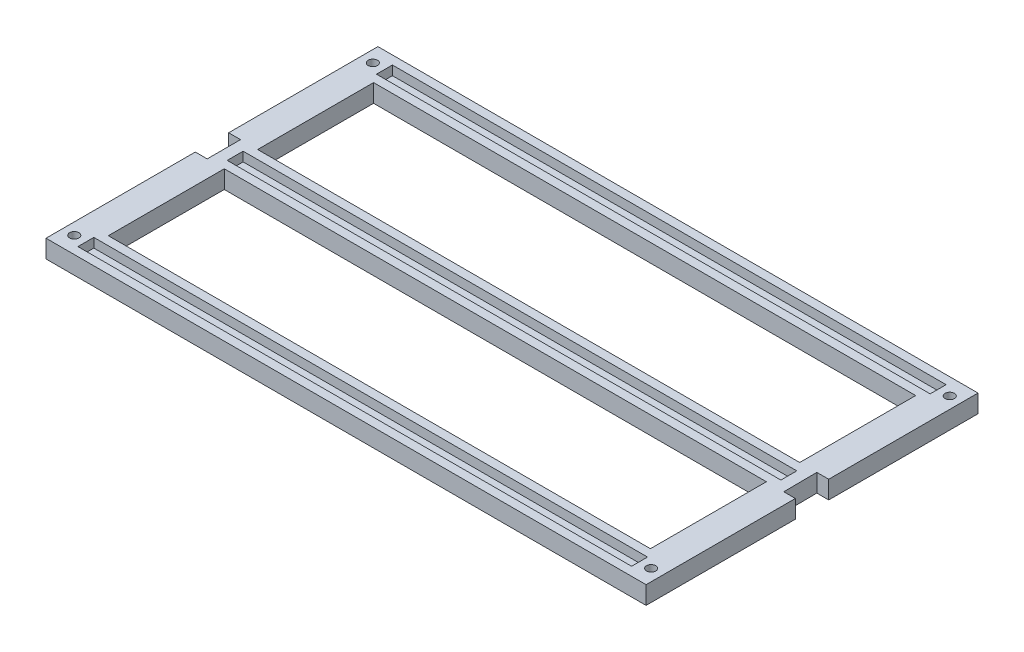
from build123d import *

# Parameters (mm, degrees)
SKETCH1_W           = 187
SKETCH1_H           = 40
SKETCH1_W_2         = 191
SKETCH1_H_2         = 5.5
SKETCH1_R           = 1.6
BOSS_EXTRUDE1_DEPTH = 3.2
BOSS_EXTRUDE2_START = -3
SKETCH1_3_W         = 187
SKETCH1_3_H         = 40
SKETCH1_3_R         = 1.6
BOSS_EXTRUDE2_DEPTH = 3


with BuildPart() as part:
    # Sketch1 → Boss-Extrude1 (new body)
    with BuildSketch(Plane(origin=(0, 0, 0), x_dir=(1, 0, 0), z_dir=(0, 1, 0))):
        Polygon((-103.5, -57.25), (103.5, -57.25), (103.5, -5.75), (99.5, -5.75), (99.4, 5.75), (103.5, 5.75), (103.5, 57.25), (-103.5, 57.25), (-103.5, 5.75), (-99.4, 5.75), (-99.4, -5.75), (-103.5, -5.75), align=None)
        with Locations((0, 25.75)):
            Rectangle(SKETCH1_W, SKETCH1_H, mode=Mode.SUBTRACT)
        Polygon((-95.5, 2.75), (93.5, 2.75), (95.5, 2.75), (95.5, -2.75), (-95.5, -2.75), align=None, mode=Mode.SUBTRACT)
        with Locations((0, -25.75)):
            Rectangle(SKETCH1_W, SKETCH1_H, mode=Mode.SUBTRACT)
        with Locations((0, -51.5)):
            Rectangle(SKETCH1_W_2, SKETCH1_H_2, mode=Mode.SUBTRACT)
        with Locations((0, 51.5)):
            Rectangle(SKETCH1_W_2, SKETCH1_H_2, mode=Mode.SUBTRACT)
        with Locations((-99.5, -51.5)):
            Circle(SKETCH1_R, mode=Mode.SUBTRACT)
        with Locations((-99.5, 51.5)):
            Circle(SKETCH1_R, mode=Mode.SUBTRACT)
        with Locations((99.5, 51.5)):
            Circle(SKETCH1_R, mode=Mode.SUBTRACT)
        with Locations((99.5, -51.5)):
            Circle(SKETCH1_R, mode=Mode.SUBTRACT)
    extrude(amount=BOSS_EXTRUDE1_DEPTH)

    # Sketch1<3> → Boss-Extrude2 (add)
    with BuildSketch(Plane(origin=(0, 0, 0), x_dir=(1, 0, 0), z_dir=(0, 1, 0)).offset(BOSS_EXTRUDE2_START)):
        Polygon((-103.5, -57.25), (103.5, -57.25), (103.5, -5.75), (99.5, -5.75), (99.4, 5.75), (103.5, 5.75), (103.5, 57.25), (-103.5, 57.25), (-103.5, 5.75), (-99.4, 5.75), (-99.4, -5.75), (-103.5, -5.75), align=None)
        with Locations((0, 25.75)):
            Rectangle(SKETCH1_3_W, SKETCH1_3_H, mode=Mode.SUBTRACT)
        with Locations((0, -25.75)):
            Rectangle(SKETCH1_3_W, SKETCH1_3_H, mode=Mode.SUBTRACT)
        with Locations((-99.5, -51.5)):
            Circle(SKETCH1_3_R, mode=Mode.SUBTRACT)
        with Locations((-99.5, 51.5)):
            Circle(SKETCH1_3_R, mode=Mode.SUBTRACT)
        with Locations((99.5, -51.5)):
            Circle(SKETCH1_3_R, mode=Mode.SUBTRACT)
        with Locations((99.5, 51.5)):
            Circle(SKETCH1_3_R, mode=Mode.SUBTRACT)
    extrude(amount=BOSS_EXTRUDE2_DEPTH)


solid = part.part
